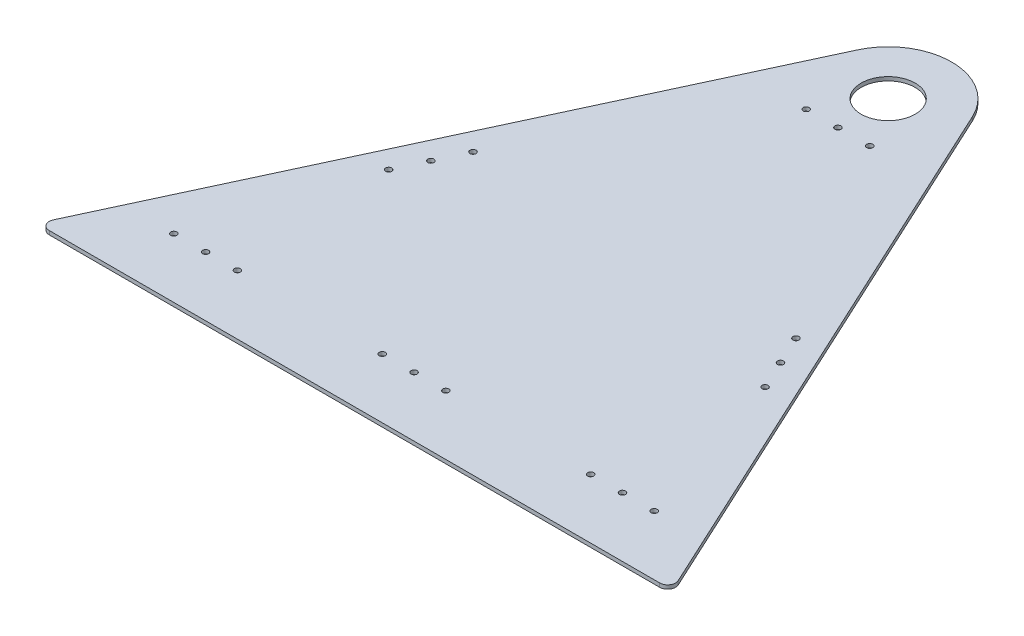
from build123d import *

# Parameters (mm, degrees)
SKETCH1_R                   = 21.59
BASE_FLANGE1_DEPTH          = 3.03784
F_11_0_191_DIAMETER_HOLE1_D = 4.8514
F_11_0_191_DIAMETER_HOLE2_D = 4.8514


# Sheet-metal steps are written as plain solids
with BuildPart() as part:
    # Sketch1 → Base-Flange1 (new body)
    with BuildSketch(Plane(origin=(0, 0, 0), x_dir=(1, 0, 0), z_dir=(0, 1, 0))):
        with BuildLine():
            Line((9.946664741, 0), (498.053335259, 0))
            ThreePointArc((498.053335259, 0), (503.405631357, 2.933067681), (503.813471801, 9.022700323))
            Line((503.813471801, 9.022700323), (300.081092338, 448.101602582))
            ThreePointArc((300.081092338, 448.101602582), (254, 477.52), (207.918907662, 448.101602582))
            Line((207.918907662, 448.101602582), (4.186528199, 9.022700323))
            ThreePointArc((4.186528199, 9.022700323), (4.594368643, 2.933067681), (9.946664741, 0))
        make_face()
        with Locations(Location((254, 426.72, 0), (0, 0, 270))):
            Circle(SKETCH1_R, mode=Mode.SUBTRACT)
    extrude(amount=-BASE_FLANGE1_DEPTH)

    # #11 (0.191) Diameter Hole1 (through all)
    with Locations(Plane(origin=(0, 0, 0), x_dir=(1, 0, 0), z_dir=(0, 1, 0))):
        with Locations((61.947885367, 47.625), (87.347885367, 47.625), (112.747885367, 47.625), (228.6, 47.625), (254, 47.625), (446.052114633, 47.625), (420.652114633, 47.625), (395.252114633, 47.625), (279.4, 47.625), (103.499910638, 177.8), (114.190711929, 200.840546169), (124.88151322, 223.881092338), (404.500089362, 177.8), (393.809288071, 200.840546169), (383.11848678, 223.881092338)):
            Hole(F_11_0_191_DIAMETER_HOLE1_D / 2)

    # #11 (0.191) Diameter Hole2 (through all)
    with Locations(Plane(origin=(0, 0, 0), x_dir=(1, 0, 0), z_dir=(0, 1, 0))):
        with Locations((228.6, 386.588000012), (254, 386.588000012), (279.4, 386.588000012)):
            Hole(F_11_0_191_DIAMETER_HOLE2_D / 2)


solid = part.part
